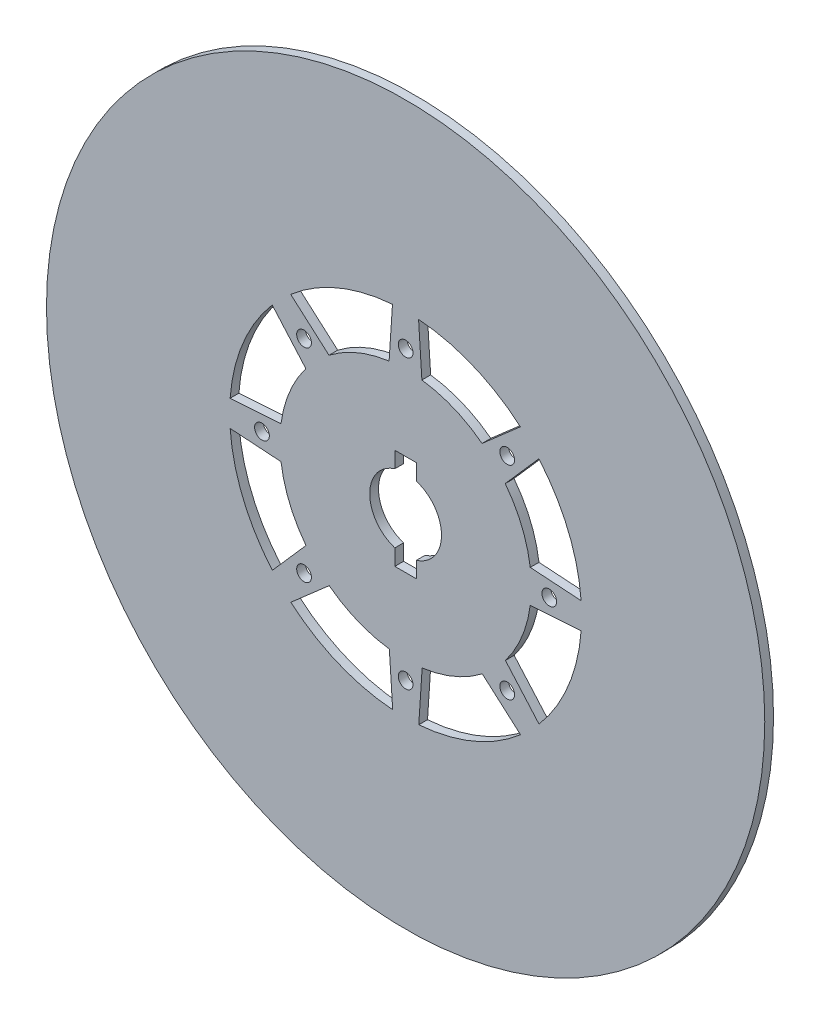
from build123d import *

# Parameters (mm, degrees)
BOSS_EXTRUDE1_OUTLINE_R = 50
BOSS_EXTRUDE1_DEPTH     = 1.22
SKETCH2_R               = 1.025
CUT_EXTRUDE2_DEPTH      = 10


# Read off the part's stored shape, not the designer's step: Boss-Extrude1
with BuildPart() as part:
    # Boss-Extrude1 outline → Boss-Extrude1 (new body)
    with BuildSketch(Plane.XY):
        Circle(BOSS_EXTRUDE1_OUTLINE_R)
        with BuildLine():
            ThreePointArc((-10.640683383, -13.893374577), (-6.680080661, -16.174873179), (-2.263779528, -17.352962348))
            Line((-2.263779528, -17.352962348), (-1.802339331, -24.433615634))
            ThreePointArc((-1.802339331, -24.433615634), (-9.36241701, -22.64056421), (-15.980874836, -18.570450707))
            Line((-15.980874836, -18.570450707), (-10.640683383, -13.893374577))
        make_face(mode=Mode.SUBTRACT)
        with BuildLine():
            ThreePointArc((-17.348198754, -2.3), (-16.160892844, -6.713832175), (-13.871131205, -10.669663495))
            Line((-13.871131205, -10.669663495), (-18.551621667, -16.00272894))
            ThreePointArc((-18.551621667, -16.00272894), (-22.629525039, -9.389067926), (-24.431476591, -1.831106659))
            Line((-24.431476591, -1.831106659), (-17.348198754, -2.3))
        make_face(mode=Mode.SUBTRACT)
        with BuildLine():
            ThreePointArc((2.3, -17.348198754), (6.713832175, -16.160892844), (10.669663495, -13.871131205))
            Line((10.669663495, -13.871131205), (16.00272894, -18.551621667))
            ThreePointArc((16.00272894, -18.551621667), (9.389067926, -22.629525039), (1.831106659, -24.431476591))
            Line((1.831106659, -24.431476591), (2.3, -17.348198754))
        make_face(mode=Mode.SUBTRACT)
        with BuildLine():
            ThreePointArc((13.893374577, -10.640683383), (16.174873179, -6.680080661), (17.352962348, -2.263779528))
            Line((17.352962348, -2.263779528), (24.433615634, -1.802339331))
            ThreePointArc((24.433615634, -1.802339331), (22.64056421, -9.36241701), (18.570450707, -15.980874836))
            Line((18.570450707, -15.980874836), (13.893374577, -10.640683383))
        make_face(mode=Mode.SUBTRACT)
        with BuildLine():
            ThreePointArc((-13.893374577, 10.640683383), (-16.174873179, 6.680080661), (-17.352962348, 2.263779528))
            Line((-17.352962348, 2.263779528), (-24.433615634, 1.802339331))
            ThreePointArc((-24.433615634, 1.802339331), (-22.64056421, 9.36241701), (-18.570450707, 15.980874836))
            Line((-18.570450707, 15.980874836), (-13.893374577, 10.640683383))
        make_face(mode=Mode.SUBTRACT)
        with BuildLine():
            ThreePointArc((-2.3, 17.348198754), (-6.713832175, 16.160892844), (-10.669663495, 13.871131205))
            Line((-10.669663495, 13.871131205), (-16.00272894, 18.551621667))
            ThreePointArc((-16.00272894, 18.551621667), (-9.389067926, 22.629525039), (-1.831106659, 24.431476591))
            Line((-1.831106659, 24.431476591), (-2.3, 17.348198754))
        make_face(mode=Mode.SUBTRACT)
        with BuildLine():
            ThreePointArc((-1.5, -4.769696007), (-5, 0), (-1.5, 4.769696007))
            Line((-1.5, 4.769696007), (-1.5, 7))
            Line((-1.5, 7), (1.5, 7))
            Line((1.5, 7), (1.5, 4.769696007))
            ThreePointArc((1.5, 4.769696007), (5, 0), (1.5, -4.769696007))
            Line((1.5, -4.769696007), (1.5, -7))
            Line((1.5, -7), (-1.5, -7))
            Line((-1.5, -7), (-1.5, -4.769696007))
        make_face(mode=Mode.SUBTRACT)
        with BuildLine():
            ThreePointArc((17.348198754, 2.3), (16.160892844, 6.713832175), (13.871131205, 10.669663495))
            Line((13.871131205, 10.669663495), (18.551621667, 16.00272894))
            ThreePointArc((18.551621667, 16.00272894), (22.629525039, 9.389067926), (24.431476591, 1.831106659))
            Line((24.431476591, 1.831106659), (17.348198754, 2.3))
        make_face(mode=Mode.SUBTRACT)
        with BuildLine():
            ThreePointArc((10.640683383, 13.893374577), (6.680080661, 16.174873179), (2.263779528, 17.352962348))
            Line((2.263779528, 17.352962348), (1.802339331, 24.433615634))
            ThreePointArc((1.802339331, 24.433615634), (9.36241701, 22.64056421), (15.980874836, 18.570450707))
            Line((15.980874836, 18.570450707), (10.640683383, 13.893374577))
        make_face(mode=Mode.SUBTRACT)
    extrude(amount=BOSS_EXTRUDE1_DEPTH)

    # Sketch2 → Cut-Extrude2 (cut)
    with BuildSketch(Plane.XY):
        with Locations((0, 20)):
            Circle(SKETCH2_R)
        with Locations((14.142135624, 14.142135624)):
            Circle(SKETCH2_R)
        with Locations((20, 0)):
            Circle(SKETCH2_R)
        with Locations((14.142135624, -14.142135624)):
            Circle(SKETCH2_R)
        with Locations((0, -20)):
            Circle(SKETCH2_R)
        with Locations((-14.142135624, -14.142135624)):
            Circle(SKETCH2_R)
        with Locations((-20, 0)):
            Circle(SKETCH2_R)
        with Locations((-14.142135624, 14.142135624)):
            Circle(SKETCH2_R)
    extrude(amount=CUT_EXTRUDE2_DEPTH, mode=Mode.SUBTRACT)


solid = part.part
